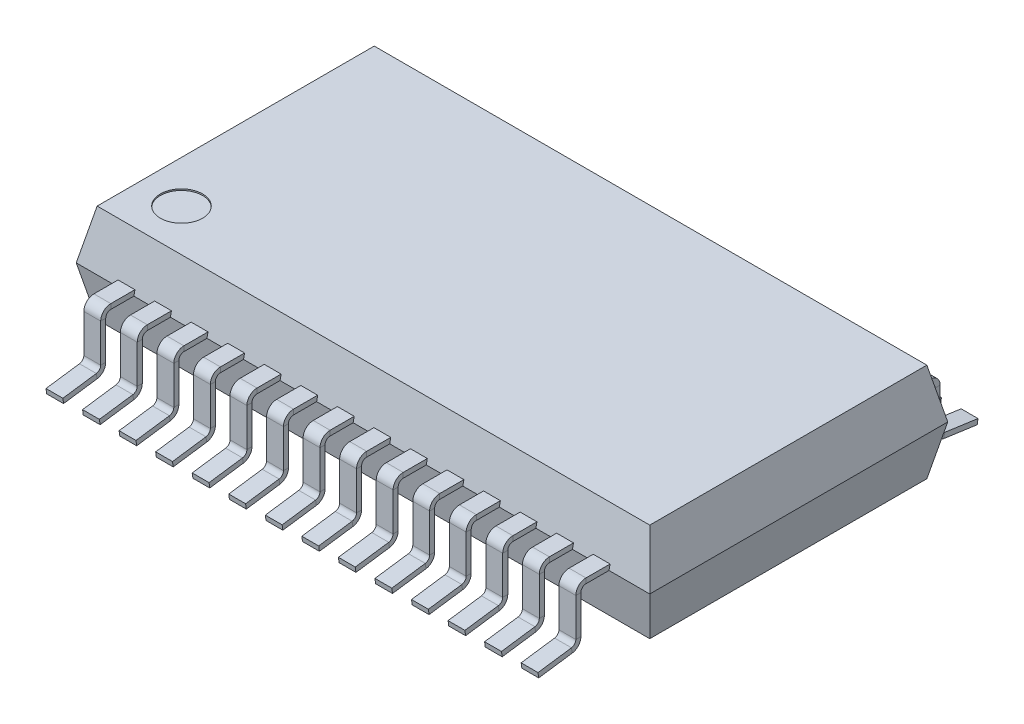
from build123d import *

# Parameters (mm, degrees)
SKETCH1_W                     = 10.2
SKETCH1_H                     = 5.3
BOSS_EXTRUDE1_DEPTH           = 0.875
BOSS_EXTRUDE1_TAPER           = 12
BOSS_EXTRUDE1_OTHER_WAY_DEPTH = 0.875
BOSS_EXTRUDE1_OTHER_WAY_TAPER = 12
BASE_FLANGE1_DEPTH            = 0.15
BASE_FLANGE1_DEPTH_BACK       = 0.15
LPATTERN1_COUNT               = 8
LPATTERN1_PITCH               = 0.65
LPATTERN1_2_COUNT             = 7
LPATTERN1_2_PITCH             = 0.65
BASE_FLANGE2_DEPTH            = 0.15
BASE_FLANGE2_DEPTH_BACK       = 0.15
LPATTERN2_COUNT               = 7
LPATTERN2_PITCH               = 0.65
LPATTERN2_2_COUNT             = 8
LPATTERN2_2_PITCH             = 0.65
SKETCH87_R                    = 0.375
CUT_EXTRUDE1_DEPTH            = 0.025


# Sheet-metal steps are written as plain solids
with BuildPart() as part:
    # Sketch1 → Boss-Extrude1 (new body)
    with BuildSketch(Plane(origin=(0, 0, 0), x_dir=(1, 0, 0), z_dir=(0, 1, 0))):
        Rectangle(SKETCH1_W, SKETCH1_H)
    extrude(amount=BOSS_EXTRUDE1_DEPTH, taper=BOSS_EXTRUDE1_TAPER)

    # Sketch1 → Boss-Extrude1 other way (add)
    with BuildSketch(Plane(origin=(0, 0, 0), x_dir=(1, 0, 0), z_dir=(0, 1, 0))):
        Rectangle(SKETCH1_W, SKETCH1_H)
    extrude(amount=-BOSS_EXTRUDE1_OTHER_WAY_DEPTH, taper=BOSS_EXTRUDE1_OTHER_WAY_TAPER)

    # Sketch87 → Cut-Extrude1 (cut)
    with BuildSketch(Plane(origin=(0, 0.875, 0), x_dir=(1, 0, 0), z_dir=(0, 1, 0))):
        with Locations(Location((-4.164013009, -1.714013009, 0), (0, 0, 270))):
            Circle(SKETCH87_R)
    extrude(amount=-CUT_EXTRUDE1_DEPTH, mode=Mode.SUBTRACT)


with BuildPart() as body_2:
    # Sketch2 → Base-Flange1 (new, two sides: drawn at the far end of the back side and taken through both)
    with BuildSketch(Plane(origin=(-0.325, 0, 0), x_dir=(0, 0, -1), z_dir=(1, 0, 0)).offset(-BASE_FLANGE1_DEPTH_BACK)):
        with BuildLine():
            Line((-2.55, 0), (-2.65, 0))
            Line((-2.65, 0), (-3.06, 0))
            ThreePointArc((-3.06, 0), (-3.12363961, -0.02636039), (-3.15, -0.09))
            Line((-3.15, -0.09), (-3.15, -0.768528387))
            ThreePointArc((-3.15, -0.768528387), (-3.194152276, -0.886619012), (-3.304948842, -0.94677664))
            Line((-3.304948842, -0.94677664), (-3.9, -1.030405626))
            Line((-3.9, -1.030405626), (-3.912525579, -0.9412815))
            Line((-3.912525579, -0.9412815), (-3.317474421, -0.857652513))
            ThreePointArc((-3.317474421, -0.857652513), (-3.262076138, -0.8275737), (-3.24, -0.768528387))
            Line((-3.24, -0.768528387), (-3.24, -0.09))
            ThreePointArc((-3.24, -0.09), (-3.187279221, 0.037279221), (-3.06, 0.09))
            Line((-3.06, 0.09), (-2.65, 0.09))
            Line((-2.65, 0.09), (-2.55, 0.09))
            Line((-2.55, 0.09), (-2.55, 0))
        make_face()
    extrude(amount=BASE_FLANGE1_DEPTH + BASE_FLANGE1_DEPTH_BACK)


with BuildPart() as lpattern1_1:
    # LPattern1: pattern copy
    add(body_2.part.moved(Location(Vector(1, 0, 0) * (1 * LPATTERN1_PITCH))))


with BuildPart() as lpattern1_2:
    # LPattern1: pattern copy
    add(body_2.part.moved(Location(Vector(1, 0, 0) * (2 * LPATTERN1_PITCH))))


with BuildPart() as lpattern1_3:
    # LPattern1: pattern copy
    add(body_2.part.moved(Location(Vector(1, 0, 0) * (3 * LPATTERN1_PITCH))))


with BuildPart() as lpattern1_4:
    # LPattern1: pattern copy
    add(body_2.part.moved(Location(Vector(1, 0, 0) * (4 * LPATTERN1_PITCH))))


with BuildPart() as lpattern1_5:
    # LPattern1: pattern copy
    add(body_2.part.moved(Location(Vector(1, 0, 0) * (5 * LPATTERN1_PITCH))))


with BuildPart() as lpattern1_6:
    # LPattern1: pattern copy
    add(body_2.part.moved(Location(Vector(1, 0, 0) * (6 * LPATTERN1_PITCH))))


with BuildPart() as lpattern1_7:
    # LPattern1: pattern copy
    add(body_2.part.moved(Location(Vector(1, 0, 0) * (7 * LPATTERN1_PITCH))))


with BuildPart() as lpattern1_2_1:
    # LPattern1 2: pattern copy
    add(body_2.part.moved(Location(Vector(-1, 0, 0) * (1 * LPATTERN1_2_PITCH))))


with BuildPart() as lpattern1_2_2:
    # LPattern1 2: pattern copy
    add(body_2.part.moved(Location(Vector(-1, 0, 0) * (2 * LPATTERN1_2_PITCH))))


with BuildPart() as lpattern1_2_3:
    # LPattern1 2: pattern copy
    add(body_2.part.moved(Location(Vector(-1, 0, 0) * (3 * LPATTERN1_2_PITCH))))


with BuildPart() as lpattern1_2_4:
    # LPattern1 2: pattern copy
    add(body_2.part.moved(Location(Vector(-1, 0, 0) * (4 * LPATTERN1_2_PITCH))))


with BuildPart() as lpattern1_2_5:
    # LPattern1 2: pattern copy
    add(body_2.part.moved(Location(Vector(-1, 0, 0) * (5 * LPATTERN1_2_PITCH))))


with BuildPart() as lpattern1_2_6:
    # LPattern1 2: pattern copy
    add(body_2.part.moved(Location(Vector(-1, 0, 0) * (6 * LPATTERN1_2_PITCH))))


with BuildPart() as body_16:
    # Sketch58 → Base-Flange2 (new, two sides: drawn at the far end of the back side and taken through both)
    with BuildSketch(Plane(origin=(-0.325, 0, 0), x_dir=(0, 0, -1), z_dir=(1, 0, 0)).offset(-BASE_FLANGE2_DEPTH_BACK)):
        with BuildLine():
            Line((2.55, 0), (2.65, 0))
            Line((2.65, 0), (3.06, 0))
            ThreePointArc((3.06, 0), (3.12363961, -0.02636039), (3.15, -0.09))
            Line((3.15, -0.09), (3.15, -0.768528387))
            ThreePointArc((3.15, -0.768528387), (3.194152276, -0.886619012), (3.304948842, -0.94677664))
            Line((3.304948842, -0.94677664), (3.9, -1.030405626))
            Line((3.9, -1.030405626), (3.912525579, -0.9412815))
            Line((3.912525579, -0.9412815), (3.317474421, -0.857652513))
            ThreePointArc((3.317474421, -0.857652513), (3.262076138, -0.8275737), (3.24, -0.768528387))
            Line((3.24, -0.768528387), (3.24, -0.09))
            ThreePointArc((3.24, -0.09), (3.187279221, 0.037279221), (3.06, 0.09))
            Line((3.06, 0.09), (2.65, 0.09))
            Line((2.65, 0.09), (2.55, 0.09))
            Line((2.55, 0.09), (2.55, 0))
        make_face()
    extrude(amount=BASE_FLANGE2_DEPTH + BASE_FLANGE2_DEPTH_BACK)


with BuildPart() as lpattern2_1:
    # LPattern2: pattern copy
    add(body_16.part.moved(Location(Vector(-1, 0, 0) * (1 * LPATTERN2_PITCH))))


with BuildPart() as lpattern2_2:
    # LPattern2: pattern copy
    add(body_16.part.moved(Location(Vector(-1, 0, 0) * (2 * LPATTERN2_PITCH))))


with BuildPart() as lpattern2_3:
    # LPattern2: pattern copy
    add(body_16.part.moved(Location(Vector(-1, 0, 0) * (3 * LPATTERN2_PITCH))))


with BuildPart() as lpattern2_4:
    # LPattern2: pattern copy
    add(body_16.part.moved(Location(Vector(-1, 0, 0) * (4 * LPATTERN2_PITCH))))


with BuildPart() as lpattern2_5:
    # LPattern2: pattern copy
    add(body_16.part.moved(Location(Vector(-1, 0, 0) * (5 * LPATTERN2_PITCH))))


with BuildPart() as lpattern2_6:
    # LPattern2: pattern copy
    add(body_16.part.moved(Location(Vector(-1, 0, 0) * (6 * LPATTERN2_PITCH))))


with BuildPart() as lpattern2_2_1:
    # LPattern2 2: pattern copy
    add(body_16.part.moved(Location(Vector(1, 0, 0) * (1 * LPATTERN2_2_PITCH))))


with BuildPart() as lpattern2_2_2:
    # LPattern2 2: pattern copy
    add(body_16.part.moved(Location(Vector(1, 0, 0) * (2 * LPATTERN2_2_PITCH))))


with BuildPart() as lpattern2_2_3:
    # LPattern2 2: pattern copy
    add(body_16.part.moved(Location(Vector(1, 0, 0) * (3 * LPATTERN2_2_PITCH))))


with BuildPart() as lpattern2_2_4:
    # LPattern2 2: pattern copy
    add(body_16.part.moved(Location(Vector(1, 0, 0) * (4 * LPATTERN2_2_PITCH))))


with BuildPart() as lpattern2_2_5:
    # LPattern2 2: pattern copy
    add(body_16.part.moved(Location(Vector(1, 0, 0) * (5 * LPATTERN2_2_PITCH))))


with BuildPart() as lpattern2_2_6:
    # LPattern2 2: pattern copy
    add(body_16.part.moved(Location(Vector(1, 0, 0) * (6 * LPATTERN2_2_PITCH))))


with BuildPart() as lpattern2_2_7:
    # LPattern2 2: pattern copy
    add(body_16.part.moved(Location(Vector(1, 0, 0) * (7 * LPATTERN2_2_PITCH))))


solid = Compound([part.part, body_2.part, lpattern1_1.part, lpattern1_2.part, lpattern1_3.part, lpattern1_4.part, lpattern1_5.part, lpattern1_6.part, lpattern1_7.part, lpattern1_2_1.part, lpattern1_2_2.part, lpattern1_2_3.part, lpattern1_2_4.part, lpattern1_2_5.part, lpattern1_2_6.part, body_16.part, lpattern2_1.part, lpattern2_2.part, lpattern2_3.part, lpattern2_4.part, lpattern2_5.part, lpattern2_6.part, lpattern2_2_1.part, lpattern2_2_2.part, lpattern2_2_3.part, lpattern2_2_4.part, lpattern2_2_5.part, lpattern2_2_6.part, lpattern2_2_7.part])
